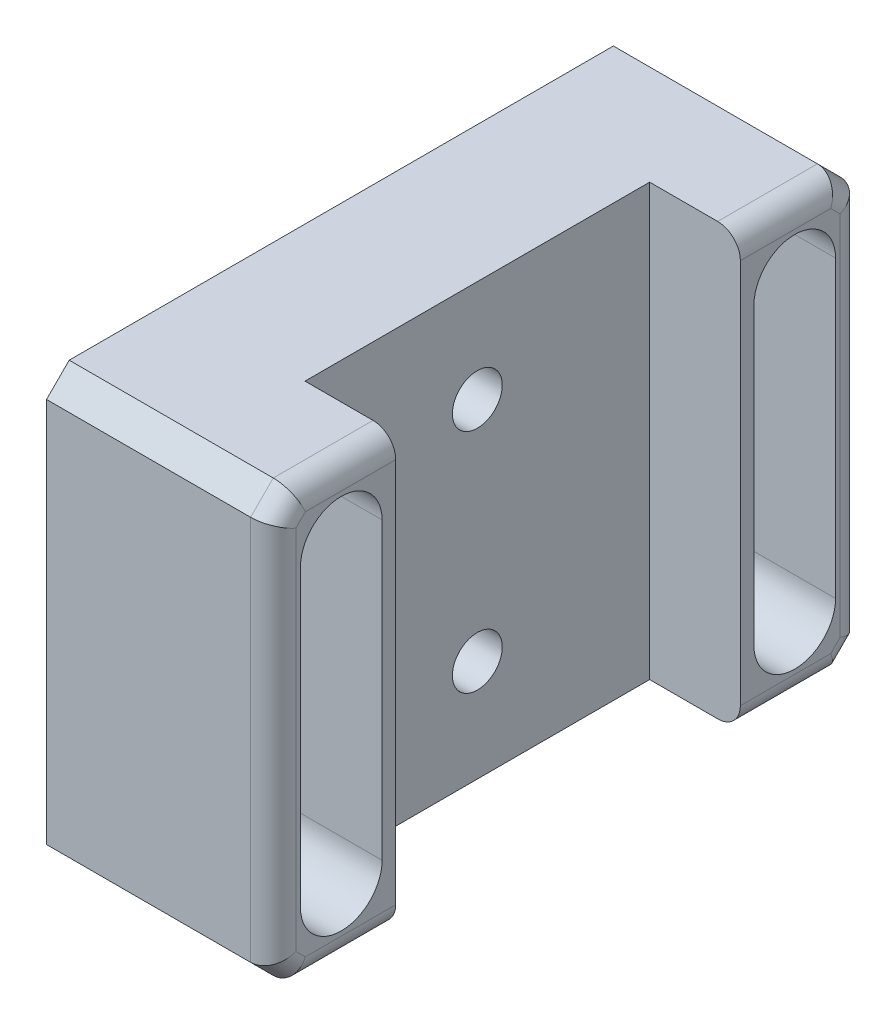
from build123d import *

# Parameters (mm, degrees)
SKETCH_1_W          = 26
SKETCH_1_H          = 19
EXTRUDE_1_DEPTH     = 10
SKETCH_2_W          = 15.2
SKETCH_2_H          = 19
CUT_EXTRUDE_1_DEPTH = 4
CUT_EXTRUDE_2_DEPTH = 4
CHAMFER_1_SIZE      = 1
FILLET_1_R          = 1
SKETCH_4_R          = 1.1
CUT_EXTRUDE_3_DEPTH = 18.182840277
CUT_EXTRUDE_4_DEPTH = 2.2


with BuildPart() as part:
    # Эскиз1 → Бобышка-Вытянуть1 (new body)
    with BuildSketch(Plane(origin=(0, 0, 0), x_dir=(0, 0, -1), z_dir=(1, 0, 0))):
        Rectangle(SKETCH_1_W, SKETCH_1_H)
        with BuildLine():
            Line((-8.9, 6.5), (-8.9, -6.5))
            ThreePointArc((-8.9, -6.5), (-10, -7.6), (-11.1, -6.5))
            Line((-11.1, -6.5), (-11.1, 6.5))
            ThreePointArc((-11.1, 6.5), (-10, 7.6), (-8.9, 6.5))
        make_face(mode=Mode.SUBTRACT)
        with BuildLine():
            Line((8.9, 6.5), (8.9, -6.5))
            ThreePointArc((8.9, -6.5), (10, -7.6), (11.1, -6.5))
            Line((11.1, -6.5), (11.1, 6.5))
            ThreePointArc((11.1, 6.5), (10, 7.6), (8.9, 6.5))
        make_face(mode=Mode.SUBTRACT)
    extrude(amount=EXTRUDE_1_DEPTH)

    # Эскиз2 → Вырез-Вытянуть1 (cut)
    with BuildSketch(Plane(origin=(10, 0, 0), x_dir=(0, 0, -1), z_dir=(1, 0, 0))):
        Rectangle(SKETCH_2_W, SKETCH_2_H)
    extrude(amount=-CUT_EXTRUDE_1_DEPTH, mode=Mode.SUBTRACT)

    # Эскиз3 → Вырез-Вытянуть2 (cut)
    with BuildSketch(Plane(origin=(10, 0, 0), x_dir=(0, 0, -1), z_dir=(1, 0, 0))):
        with BuildLine():
            Line((-11.8, -6.5), (-11.8, 6.5))
            ThreePointArc((-11.8, 6.5), (-10, 8.3), (-8.2, 6.5))
            Line((-8.2, 6.5), (-8.2, -6.5))
            ThreePointArc((-8.2, -6.5), (-10, -8.3), (-11.8, -6.5))
        make_face()
        with BuildLine():
            Line((11.8, -6.5), (11.8, 6.5))
            ThreePointArc((11.8, 6.5), (10, 8.3), (8.2, 6.5))
            Line((8.2, 6.5), (8.2, -6.5))
            ThreePointArc((8.2, -6.5), (10, -8.3), (11.8, -6.5))
        make_face()
    extrude(amount=-CUT_EXTRUDE_2_DEPTH, mode=Mode.SUBTRACT)

    # Фаска1
    chamfer_1_edges = [part.edges().sort_by_distance(p)[0] for p in [
        (5, 9.5, -13),
        (5, -9.5, -13),
        (5, -9.5, 13),
        (5, 9.5, 13),
    ]]
    chamfer(chamfer_1_edges, length=CHAMFER_1_SIZE)

    # Скругление1
    fillet_1_edges = [part.edges().sort_by_distance(p)[0] for p in [
        (10, 9, 12.5),
        (10, -9, 12.5),
        (10, -9, -12.5),
        (10, -9.5, -9.8),
        (10, 0, -13),
        (10, 9, -12.5),
        (10, 9.5, -9.8),
        (10, -9.5, 9.8),
        (10, 9.5, 9.8),
        (10, 0, 13),
    ]]
    fillet(fillet_1_edges, radius=FILLET_1_R)

    # Эскиз4 → Вырез-Вытянуть3 (cut, through all)
    with BuildSketch(Plane(origin=(6, 0, 0), x_dir=(0, 0, -1), z_dir=(1, 0, 0))):
        with Locations((0, 5)):
            Circle(SKETCH_4_R)
        with Locations((0, -5)):
            Circle(SKETCH_4_R)
    extrude(amount=-CUT_EXTRUDE_3_DEPTH, mode=Mode.SUBTRACT)

    # Эскиз5 → Вырез-Вытянуть4 (cut)
    with BuildSketch(Plane.ZY):
        Polygon((1.125833025, 3.05), (2.25166605, 5), (1.125833025, 6.95), (-1.125833025, 6.95), (-2.25166605, 5), (-1.125833025, 3.05), align=None)
        Polygon((1.125833025, -6.95), (2.25166605, -5), (1.125833025, -3.05), (-1.125833025, -3.05), (-2.25166605, -5), (-1.125833025, -6.95), align=None)
    extrude(amount=-CUT_EXTRUDE_4_DEPTH, mode=Mode.SUBTRACT)


solid = part.part
